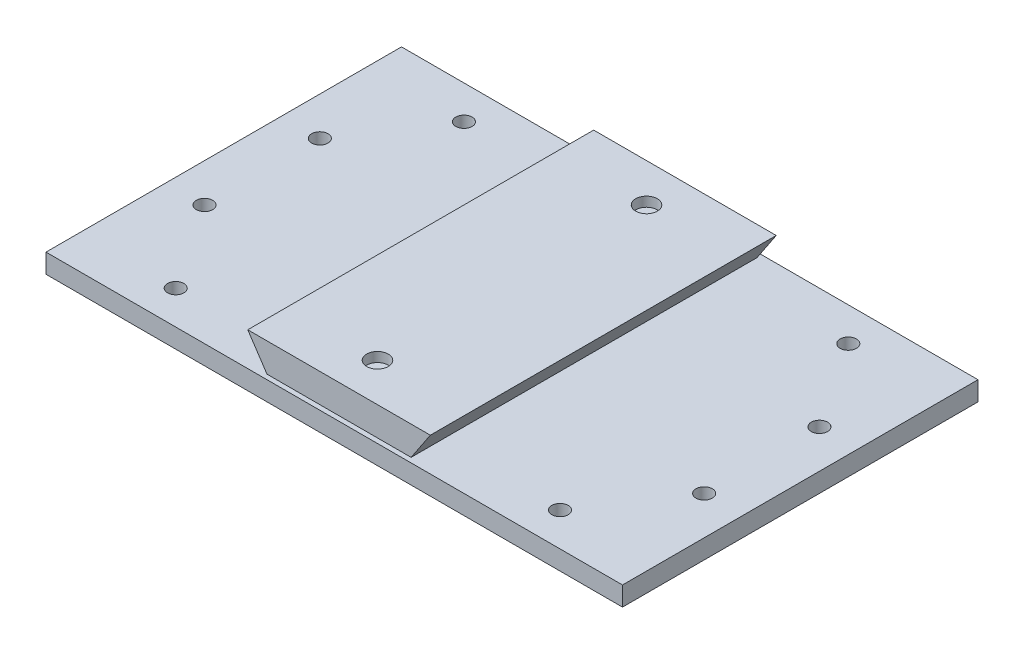
from build123d import *

# Parameters (mm, degrees)
SKETCH1_W             = 120
SKETCH1_H             = 74
RAIL_PLATE_DEPTH      = 4
DOVETAIL_RAIL_DEPTH   = 36
SKETCH3_R             = 2.25
LOCK_DETENTS_DEPTH    = 2
BOLT_HOLES_DEPTH      = 72.196910045
BOLT_HOLES_DEPTH_BACK = 72.196910045
SKETCH4_R             = 1.7


with BuildPart() as part:
    # Sketch1 → Rail Plate (new body)
    with BuildSketch(Plane(origin=(0, 0, 0), x_dir=(1, 0, 0), z_dir=(0, 1, 0))):
        Rectangle(SKETCH1_W, SKETCH1_H)
    extrude(amount=RAIL_PLATE_DEPTH)

    # Sketch2 → Dovetail Rail (add, symmetric)
    with BuildSketch(Plane.XY):
        Polygon((-14.666666667, 3.5), (14.666666667, 3.5), (19, 10), (-19, 10), align=None)
    extrude(amount=DOVETAIL_RAIL_DEPTH, both=True)

    # Sketch3 → Lock Detents (cut)
    with BuildSketch(Plane(origin=(0, 10, 0), x_dir=(1, 0, 0), z_dir=(0, 1, 0))):
        with Locations((0, -28)):
            Circle(SKETCH3_R)
        with Locations((0, 28)):
            Circle(SKETCH3_R)
    extrude(amount=-LOCK_DETENTS_DEPTH, mode=Mode.SUBTRACT)

    # Sketch4 → Bolt Holes (cut, two sides: drawn at the far end of the back side and taken through both)
    with BuildSketch(Plane(origin=(0, 0, 0), x_dir=(1, 0, 0), z_dir=(0, 1, 0)).offset(-BOLT_HOLES_DEPTH_BACK)):
        with Locations((-40, -30)):
            Circle(SKETCH4_R)
        with Locations((-40, 30)):
            Circle(SKETCH4_R)
        with Locations((40, -30)):
            Circle(SKETCH4_R)
        with Locations((40, 30)):
            Circle(SKETCH4_R)
        with Locations((-52, -12)):
            Circle(SKETCH4_R)
        with Locations((-52, 12)):
            Circle(SKETCH4_R)
        with Locations((52, -12)):
            Circle(SKETCH4_R)
        with Locations((52, 12)):
            Circle(SKETCH4_R)
    extrude(amount=BOLT_HOLES_DEPTH + BOLT_HOLES_DEPTH_BACK, mode=Mode.SUBTRACT)


solid = part.part
